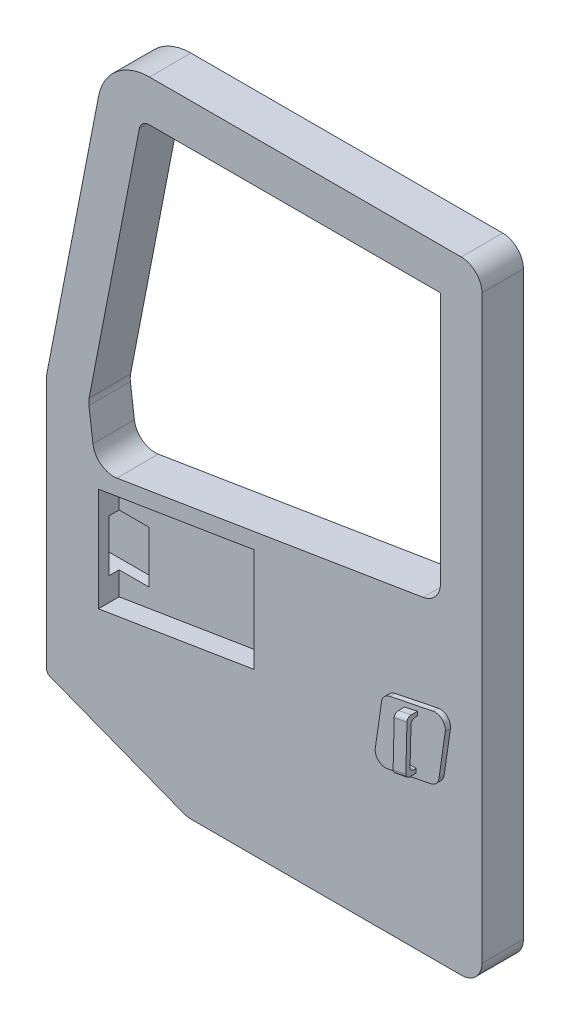
from build123d import *

# Parameters (mm, degrees)
BOSS_EXTRUDE1_DEPTH     = 50.8
BOSS_EXTRUDE2_DEPTH     = 12.7
BOSS_EXTRUDE4_DEPTH     = 38.1
CUT_EXTRUDE6_DEPTH      = 1210.417706454
CUT_EXTRUDE6_DEPTH_BACK = 1210.417706454
SKETCH6_W               = 15.24
SKETCH6_H               = 112.550701787
FILLET5_R               = 10.16
SKETCH7_W               = 63.5
SKETCH7_H               = 152.4
BOSS_EXTRUDE5_DEPTH     = 12.7
SKETCH13_R              = 11.43
CUT_EXTRUDE7_DEPTH      = 46.99
CUT_EXTRUDE8_DEPTH      = 379.73
SKETCH14_W              = 50.8
SKETCH14_H              = 127
CUT_EXTRUDE9_DEPTH      = 200.406


with BuildPart() as part:
    # Sketch2 → Boss-Extrude1 (new, symmetric)
    with BuildSketch(Plane.XY):
        with BuildLine():
            ThreePointArc((-281.22987981, 761.977974364), (-362.012905501, 732.973396503), (-405.897072003, 659.207939092))
            Line((-405.897072003, 659.207939092), (-532.543341291, 7.59185253))
            ThreePointArc((-532.543341291, 7.59185253), (-533.092098773, 4.137158691), (-533.401811702, 0.652890878))
            Line((-533.401811702, 0.652890878), (-533.401811702, -620.142657257))
            ThreePointArc((-533.401811702, -620.142657257), (-531.177949262, -627.321831432), (-525.285190942, -631.986754299))
            Line((-525.285190942, -631.986754299), (-198.102842861, -758.598413805))
            ThreePointArc((-198.102842861, -758.598413805), (-189.094546571, -761.158788241), (-179.769325902, -762.022025636))
            Line((-179.769325902, -762.022025636), (482.6, -762.022025636))
            ThreePointArc((482.6, -762.022025636), (518.521024484, -747.14305012), (533.4, -711.222025636))
            Line((533.4, -711.222025636), (533.4, 711.177974364))
            ThreePointArc((533.4, 711.177974364), (518.521024484, 747.098998848), (482.6, 761.977974364))
            Line((482.6, 761.977974364), (-281.22987981, 761.977974364))
        make_face()
        with BuildLine():
            Line((-429.158069548, 6.995547173), (-306.163318249, 639.82396731))
            ThreePointArc((-306.163318249, 639.82396731), (-297.386484948, 654.577058792), (-281.22987981, 660.377974364))
            Line((-281.22987981, 660.377974364), (431.8, 660.377974364))
            Line((431.8, 660.377974364), (431.799479011, 43.203341432))
            ThreePointArc((431.799479011, 43.203341432), (419.69896382, 10.294572798), (389.162124663, -6.936532078))
            Line((389.162124663, -6.936532078), (-361.238141486, -129.099708857))
            ThreePointArc((-361.238141486, -129.099708857), (-399.747422128, -119.699475142), (-419.778902563, -85.493205526))
            Line((-419.778902563, -85.493205526), (-429.669308096, -9.229851781))
            ThreePointArc((-429.669308096, -9.229851781), (-430.065994622, -1.096599104), (-429.158069548, 6.995547173))
        make_face(mode=Mode.SUBTRACT)
    extrude(amount=BOSS_EXTRUDE1_DEPTH, both=True)

    # Sketch3 → Boss-Extrude2 (add)
    with BuildSketch(Plane.XY.offset(50.8)):
        with BuildLine():
            ThreePointArc((320.195939672, -245.101046406), (306.776022753, -252.553855048), (300.10041124, -266.376833661))
            Line((300.10041124, -266.376833661), (284.73360266, -373.157176687))
            ThreePointArc((284.73360266, -373.157176687), (292.433567965, -395.240613926), (314.920066898, -401.669068776))
            Line((314.920066898, -401.669068776), (420.650671368, -380.239655788))
            ThreePointArc((420.650671368, -380.239655788), (434.070588287, -372.786847145), (440.7461998, -358.963868533))
            Line((440.7461998, -358.963868533), (456.11300838, -252.183525507))
            ThreePointArc((456.11300838, -252.183525507), (448.413043075, -230.100088267), (425.926544142, -223.671633417))
            Line((425.926544142, -223.671633417), (320.195939672, -245.101046406))
        make_face()
    extrude(amount=BOSS_EXTRUDE2_DEPTH)

    # Sketch5 → Boss-Extrude4 (add)
    with BuildSketch(Plane.XY.offset(50.8)):
        Polygon((384.717168986, -375.860232263), (387.95984057, -243.029104606), (356.735325181, -249.357669916), (353.492653597, -382.188797573), align=None)
    extrude(amount=BOSS_EXTRUDE4_DEPTH)

    # Sketch6 → Cut-Extrude6 (cut, two sides: drawn at the far end of the back side and taken through both)
    with BuildSketch(Plane(origin=(393.658065015, -9.60997504, 0), x_dir=(0, 0, -1), z_dir=(0.9997021605932607, -0.02440471481427925, 0)).offset(-CUT_EXTRUDE6_DEPTH_BACK)):
        with Locations((-71.12, -299.924022588)):
            Rectangle(SKETCH6_W, SKETCH6_H)
    extrude(amount=CUT_EXTRUDE6_DEPTH + CUT_EXTRUDE6_DEPTH_BACK, mode=Mode.SUBTRACT)

    # Fillet5
    fillet5_edges = [part.edges().sort_by_distance(p)[0] for p in [
        (369.104911291, -379.024514918, 88.9),
        (369.439362115, -365.324243711, 78.74),
        (372.186129895, -252.807063957, 78.74),
        (372.347582875, -246.193387261, 88.9),
    ]]
    fillet(fillet5_edges, radius=FILLET5_R)

    # Sketch7 → Boss-Extrude5 (add)
    with BuildSketch(Plane(origin=(-533.401811702, 59.373810393, 0), x_dir=(0, 0, 1), z_dir=(1, 0, 0))):
        with Locations((0, 160.320919516)):
            Rectangle(SKETCH7_W, SKETCH7_H)
        with Locations((0, 566.720919516)):
            Rectangle(SKETCH7_W, SKETCH7_H)
    extrude(amount=-BOSS_EXTRUDE5_DEPTH)

    # Sketch13 → Cut-Extrude7 (cut)
    with BuildSketch(Plane.ZY.offset(546.101811702)):
        with Locations((0, -50.147109122)):
            Circle(SKETCH13_R)
        with Locations((0, -151.747109122)):
            Circle(SKETCH13_R)
        with Locations((0, -456.547109122)):
            Circle(SKETCH13_R)
        with Locations((0, -558.147109122)):
            Circle(SKETCH13_R)
    extrude(amount=-CUT_EXTRUDE7_DEPTH, mode=Mode.SUBTRACT)

    # Sketch16 → Cut-Extrude8 (cut)
    with BuildSketch(Plane.XY):
        Polygon((-406.401811702, -175.053814928), (-25.401811702, -113.028023557), (-25.401811702, -367.028023557), (-406.401811702, -429.053814928), align=None)
    extrude(amount=CUT_EXTRUDE8_DEPTH, mode=Mode.SUBTRACT)

    # Sketch14 → Cut-Extrude9 (cut)
    with BuildSketch(Plane.ZY.offset(533.401811702)):
        with Locations((0, -308.28172325)):
            Rectangle(SKETCH14_W, SKETCH14_H)
    extrude(amount=-CUT_EXTRUDE9_DEPTH, mode=Mode.SUBTRACT)


solid = part.part
